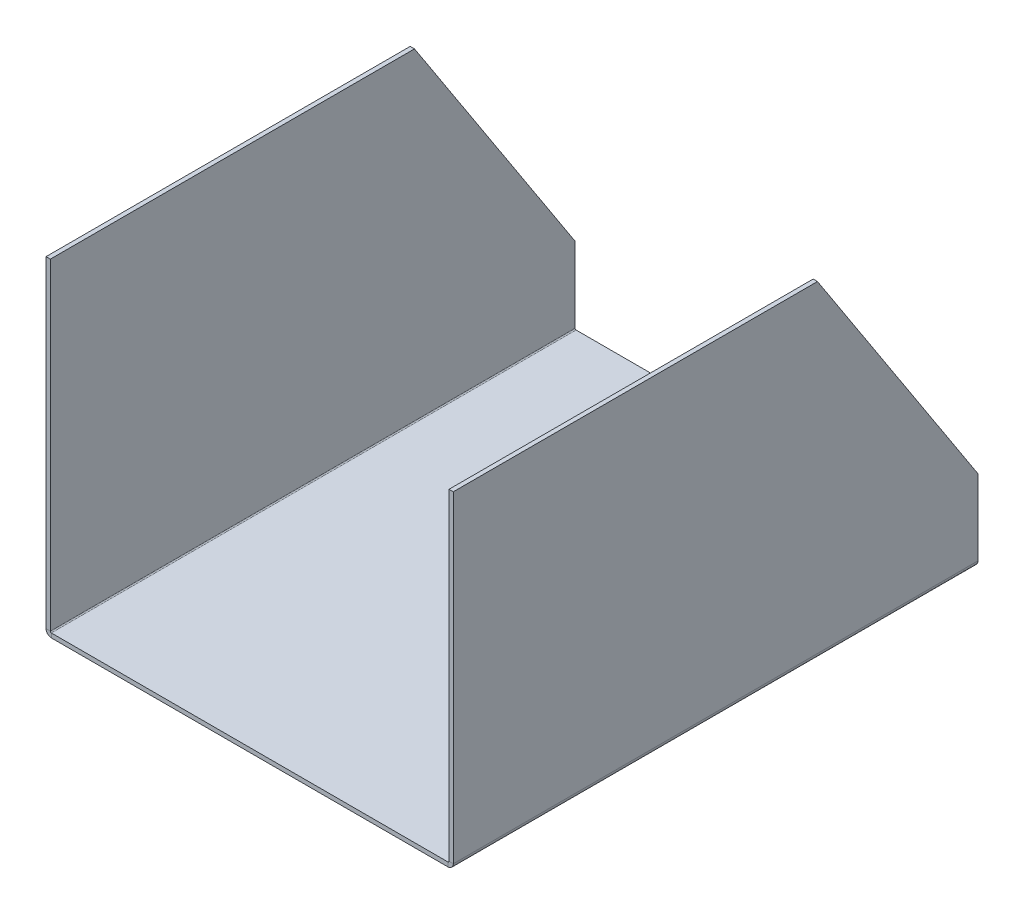
from build123d import *

# Parameters (mm, degrees)
BASE_FLANGE1_DEPTH      = 487
CUT_EXTRUDE1_DEPTH      = 686.604113173
CUT_EXTRUDE1_DEPTH_BACK = 4
CUT_EXTRUDE2_DEPTH      = 686.604113173
CUT_EXTRUDE2_DEPTH_BACK = 4


# Sheet-metal steps are written as plain solids
with BuildPart() as part:
    # Sketch1 → Base-Flange1 (new body)
    with BuildSketch(Plane.XY):
        with BuildLine():
            Line((-185, 300), (-185, 1))
            ThreePointArc((-185, 1), (-184.707106781, 0.292893219), (-184, 0))
            Line((-184, 0), (184, 0))
            ThreePointArc((184, 0), (184.707106781, 0.292893219), (185, 1))
            Line((185, 1), (185, 300))
            Line((185, 300), (189, 300))
            Line((189, 300), (189, 1))
            ThreePointArc((189, 1), (187.535533906, -2.535533906), (184, -4))
            Line((184, -4), (-184, -4))
            ThreePointArc((-184, -4), (-187.535533906, -2.535533906), (-189, 1))
            Line((-189, 1), (-189, 300))
            Line((-189, 300), (-185, 300))
        make_face()
    extrude(amount=BASE_FLANGE1_DEPTH)

    # Sketch7 → Cut-Extrude1 (cut, two sides: drawn at the far end of the back side and taken through both)
    with BuildSketch(Plane(origin=(189, 0, 0), x_dir=(0, 0, -1), z_dir=(1, 0, 0)).offset(-CUT_EXTRUDE1_DEPTH_BACK)):
        Polygon((592.444694682, -839.53580592), (0, 71), (-149, 300), (-741.444694682, 1210.53580592), (1079.626917159, 2395.425195284), (2413.516306522, 345.353583443), align=None)
    extrude(amount=CUT_EXTRUDE1_DEPTH + CUT_EXTRUDE1_DEPTH_BACK, mode=Mode.SUBTRACT)

    # Sketch9 → Cut-Extrude2 (cut, two sides: drawn at the far end of the back side and taken through both)
    with BuildSketch(Plane.ZY.offset(189).offset(-CUT_EXTRUDE2_DEPTH_BACK)):
        Polygon((741.444694682, 1210.53580592), (149, 300), (0, 71), (-592.444694682, -839.53580592), (-2413.516306522, 345.353583443), (-1079.626917159, 2395.425195284), align=None)
    extrude(amount=CUT_EXTRUDE2_DEPTH + CUT_EXTRUDE2_DEPTH_BACK, mode=Mode.SUBTRACT)


solid = part.part
